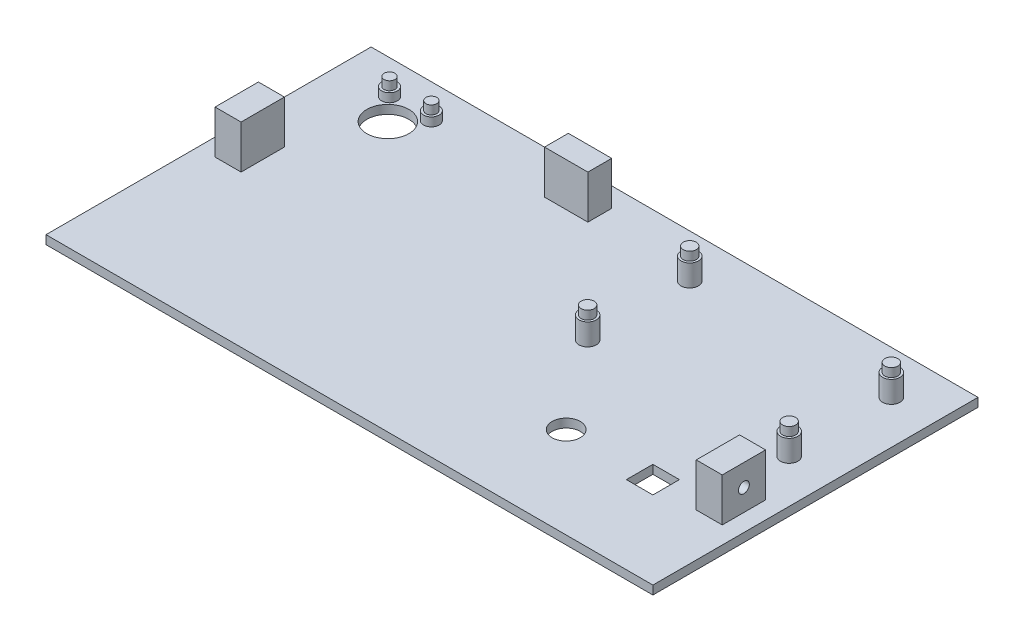
from build123d import *

# Parameters (mm, degrees)
SKETCH_1_W             = 140
SKETCH_1_H             = 75
EXTRUDE_1_DEPTH        = 2
SKETCH_4_R             = 4.85
CUT_EXTRUDE_1_DEPTH    = 80.437082021
SKETCH_5_R             = 1.8
EXTRUDE_2_DEPTH        = 2
SKETCH_18_W            = 6.12
SKETCH_18_H            = 6.12
CUT_EXTRUDE_3_DEPTH    = 4
SKETCH_19_R            = 3.25
CUT_EXTRUDE_4_DEPTH    = 4
SKETCH_21_R            = 2
EXTRUDE_3_DEPTH        = 5
SKETCH_13_R            = 1.25
EXTRUDE_4_DEPTH        = 2
SKETCH_22_R            = 1.5
EXTRUDE_5_DEPTH        = 2
SKETCH_26_W            = 10
SKETCH_26_H            = 10
EXTRUDE_6_DEPTH        = 10
SKETCH_27_W            = 10
SKETCH_27_H            = 10
CUT_EXTRUDE_5_DEPTH    = 4
HOLE_WIZARD_M3_1_D     = 2.5
HOLE_WIZARD_M3_1_DEPTH = 4
HOLE_WIZARD_M3_1_TIP   = 0.751075774
SKETCH_30_W            = 10
SKETCH_30_H            = 10
EXTRUDE_7_DEPTH        = 10
SKETCH_31_W            = 10
SKETCH_31_H            = 10
CUT_EXTRUDE_6_DEPTH    = 4
HOLE_WIZARD_M3_2_D     = 2.5
HOLE_WIZARD_M3_2_DEPTH = 4
HOLE_WIZARD_M3_2_TIP   = 0.751075774
SKETCH_34_W            = 10
SKETCH_34_H            = 10
EXTRUDE_8_DEPTH        = 10
SKETCH_35_W            = 10
SKETCH_35_H            = 10
CUT_EXTRUDE_7_DEPTH    = 4.5
HOLE_WIZARD_M3_3_D     = 2.5
HOLE_WIZARD_M3_3_DEPTH = 4
HOLE_WIZARD_M3_3_TIP   = 0.751075774


with BuildPart() as part:
    # 草图1 → 凸台-拉伸1 (new body)
    with BuildSketch(Plane(origin=(0, 0, 0), x_dir=(1, 0, 0), z_dir=(0, 1, 0))):
        Rectangle(SKETCH_1_W, SKETCH_1_H)
    extrude(amount=EXTRUDE_1_DEPTH)

    # 草图4 → 切除-拉伸1 (cut, through all)
    with BuildSketch(Plane(origin=(0, 2, 0), x_dir=(1, 0, 0), z_dir=(0, 1, 0))):
        with Locations((-53.169929947, 24.531868669)):
            Circle(SKETCH_4_R)
    extrude(amount=-CUT_EXTRUDE_1_DEPTH, mode=Mode.SUBTRACT)

    # 草图5 → 凸台-拉伸2 (add)
    with BuildSketch(Plane(origin=(0, 2, 0), x_dir=(1, 0, 0), z_dir=(0, 1, 0))):
        with Locations((-57.999929947, 29.741868669)):
            Circle(SKETCH_5_R)
        with Locations((-48.347929947, 29.741868669)):
            Circle(SKETCH_5_R)
    extrude(amount=EXTRUDE_2_DEPTH)

    # 草图18 → 切除-拉伸3 (cut)
    with BuildSketch(Plane(origin=(0, 2, 0), x_dir=(1, 0, 0), z_dir=(0, 1, 0))):
        with Locations((48.94, -16.44)):
            Rectangle(SKETCH_18_W, SKETCH_18_H)
    extrude(amount=-CUT_EXTRUDE_3_DEPTH, mode=Mode.SUBTRACT)

    # 草图19 → 切除-拉伸4 (cut)
    with BuildSketch(Plane(origin=(0, 2, 0), x_dir=(1, 0, 0), z_dir=(0, 1, 0))):
        with Locations((28.94, -16.44)):
            Circle(SKETCH_19_R)
    extrude(amount=-CUT_EXTRUDE_4_DEPTH, mode=Mode.SUBTRACT)

    # 草图21 → 凸台-拉伸3 (add)
    with BuildSketch(Plane(origin=(0, 2, 0), x_dir=(1, 0, 0), z_dir=(0, 1, 0))):
        with Locations((60, 27.5)):
            Circle(SKETCH_21_R)
        with Locations((60, 3.95)):
            Circle(SKETCH_21_R)
        with Locations((13.5, 27.5)):
            Circle(SKETCH_21_R)
        with Locations((13.5, 3.95)):
            Circle(SKETCH_21_R)
    extrude(amount=EXTRUDE_3_DEPTH)

    # 草图13 → 凸台-拉伸4 (add)
    with BuildSketch(Plane(origin=(0, 4, 0), x_dir=(1, 0, 0), z_dir=(0, 1, 0))):
        with Locations((-57.999929947, 29.741868669)):
            Circle(SKETCH_13_R)
        with Locations((-48.347929947, 29.741868669)):
            Circle(SKETCH_13_R)
    extrude(amount=EXTRUDE_4_DEPTH)

    # 草图22 → 凸台-拉伸5 (add)
    with BuildSketch(Plane(origin=(0, 7, 0), x_dir=(1, 0, 0), z_dir=(0, 1, 0))):
        with Locations((13.5, 27.5)):
            Circle(SKETCH_22_R)
        with Locations((60, 27.5)):
            Circle(SKETCH_22_R)
        with Locations((13.5, 3.95)):
            Circle(SKETCH_22_R)
        with Locations((60, 3.95)):
            Circle(SKETCH_22_R)
    extrude(amount=EXTRUDE_5_DEPTH)

    # 草图26 → 凸台-拉伸6 (add)
    with BuildSketch(Plane.ZY.offset(70)):
        with Locations((-2.5, 7)):
            Rectangle(SKETCH_26_W, SKETCH_26_H)
    extrude(amount=-EXTRUDE_6_DEPTH)

    # 草图27 → 切除-拉伸5 (cut)
    with BuildSketch(Plane.ZY.offset(70)):
        with Locations((-2.5, 7)):
            Rectangle(SKETCH_27_W, SKETCH_27_H)
    extrude(amount=-CUT_EXTRUDE_5_DEPTH, mode=Mode.SUBTRACT)

    # M3 螺纹孔1
    with Locations(Plane(origin=(-66, 7, -2.5), x_dir=(0, 0, -1), z_dir=(-1, 0, 0))):
        with Locations((0, 0)):
            Hole(HOLE_WIZARD_M3_1_D / 2, depth=HOLE_WIZARD_M3_1_DEPTH)
            with Locations((0, 0, -(HOLE_WIZARD_M3_1_DEPTH + HOLE_WIZARD_M3_1_TIP / 2))):  # 118° drill point
                Cone(0, HOLE_WIZARD_M3_1_D / 2, HOLE_WIZARD_M3_1_TIP, mode=Mode.SUBTRACT)

    # 草图30 → 凸台-拉伸7 (add)
    with BuildSketch(Plane(origin=(70, 0, 0), x_dir=(0, 0, -1), z_dir=(1, 0, 0))):
        with Locations((-12.5, 7)):
            Rectangle(SKETCH_30_W, SKETCH_30_H)
    extrude(amount=-EXTRUDE_7_DEPTH)

    # 草图31 → 切除-拉伸6 (cut)
    with BuildSketch(Plane(origin=(70, 0, 0), x_dir=(0, 0, -1), z_dir=(1, 0, 0))):
        with Locations((-12.5, 7)):
            Rectangle(SKETCH_31_W, SKETCH_31_H)
    extrude(amount=-CUT_EXTRUDE_6_DEPTH, mode=Mode.SUBTRACT)

    # M3 螺纹孔2
    with Locations(Plane(origin=(66, 7, 12.5), x_dir=(0, 0, 1), z_dir=(1, 0, 0))):
        with Locations((0, 0)):
            Hole(HOLE_WIZARD_M3_2_D / 2, depth=HOLE_WIZARD_M3_2_DEPTH)
            with Locations((0, 0, -(HOLE_WIZARD_M3_2_DEPTH + HOLE_WIZARD_M3_2_TIP / 2))):  # 118° drill point
                Cone(0, HOLE_WIZARD_M3_2_D / 2, HOLE_WIZARD_M3_2_TIP, mode=Mode.SUBTRACT)

    # 草图34 → 凸台-拉伸8 (add)
    with BuildSketch(Plane(origin=(0, 0, -37.5), x_dir=(-1, 0, 0), z_dir=(0, 0, -1))):
        with Locations((15, 7)):
            Rectangle(SKETCH_34_W, SKETCH_34_H)
    extrude(amount=-EXTRUDE_8_DEPTH)

    # 草图35 → 切除-拉伸7 (cut)
    with BuildSketch(Plane(origin=(0, 0, -37.5), x_dir=(-1, 0, 0), z_dir=(0, 0, -1))):
        with Locations((15, 7)):
            Rectangle(SKETCH_35_W, SKETCH_35_H)
    extrude(amount=-CUT_EXTRUDE_7_DEPTH, mode=Mode.SUBTRACT)

    # M3 螺纹孔3
    with Locations(Plane(origin=(-15, 7, -33), x_dir=(-1, 0, 0), z_dir=(0, 0, -1))):
        with Locations((0, 0)):
            Hole(HOLE_WIZARD_M3_3_D / 2, depth=HOLE_WIZARD_M3_3_DEPTH)
            with Locations((0, 0, -(HOLE_WIZARD_M3_3_DEPTH + HOLE_WIZARD_M3_3_TIP / 2))):  # 118° drill point
                Cone(0, HOLE_WIZARD_M3_3_D / 2, HOLE_WIZARD_M3_3_TIP, mode=Mode.SUBTRACT)


solid = part.part
